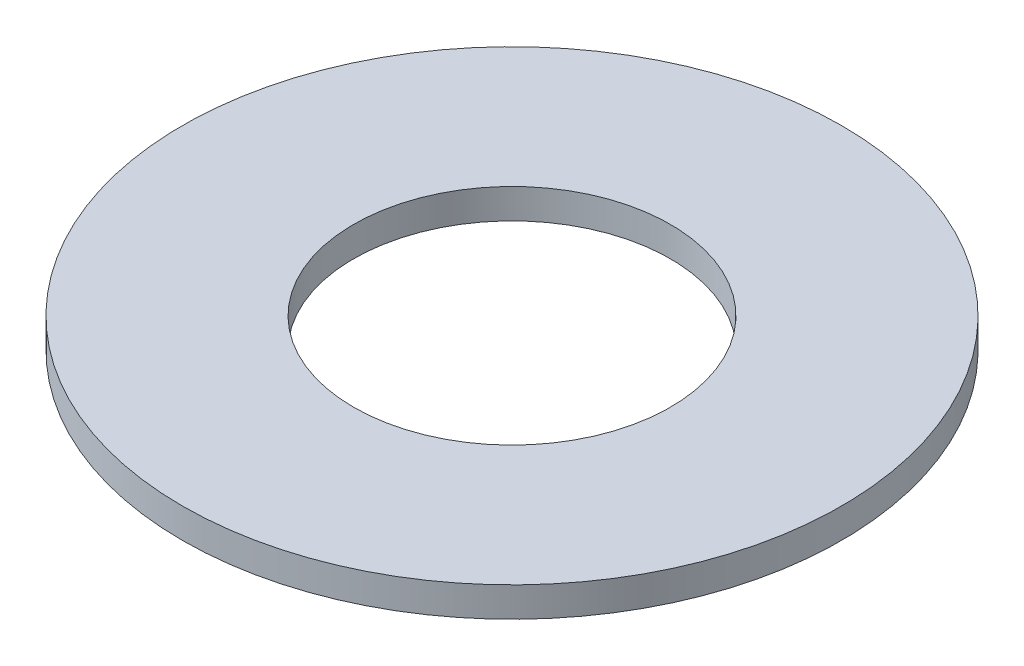
from build123d import *

# Parameters (mm, degrees)
SKETCH1_R           = 41.275
BOSS_EXTRUDE1_DEPTH = 3.7338
SKETCH5_R           = 19.8374
CUT_EXTRUDE1_DEPTH  = 59.490960946


with BuildPart() as part:
    # Sketch1 → Boss-Extrude1 (new body)
    with BuildSketch(Plane(origin=(0, 0, 0), x_dir=(1, 0, 0), z_dir=(0, 1, 0))):
        Circle(SKETCH1_R)
    extrude(amount=BOSS_EXTRUDE1_DEPTH)

    # Sketch5 → Cut-Extrude1 (cut, through all)
    with BuildSketch(Plane(origin=(0, 3.7338, 0), x_dir=(-1, 0, 0), z_dir=(0, 1, 0))):
        Circle(SKETCH5_R)
    extrude(amount=-CUT_EXTRUDE1_DEPTH, mode=Mode.SUBTRACT)


solid = part.part
